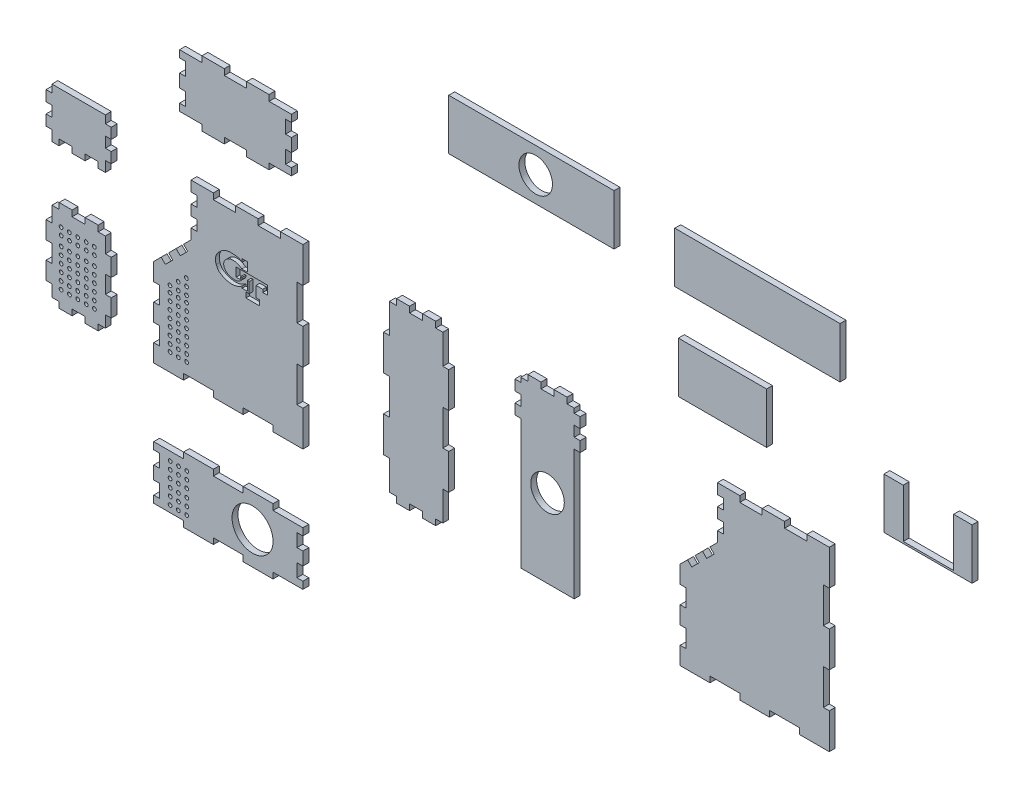
from build123d import *
from OCP.BRepAlgoAPI import BRepAlgoAPI_Cut
from OCP.TopTools import TopTools_ListOfShape

# Parameters (mm, degrees)
BOSS_EXTRUDE1_DEPTH    = 3.175
BOSS_EXTRUDE1_2_DEPTH  = 3.175
SKETCH1_W              = 35
SKETCH1_H              = 95
BOSS_EXTRUDE1_3_DEPTH  = 3.175
SKETCH1_W_2            = 47.3
SKETCH1_H_2            = 27.15
BOSS_EXTRUDE1_4_DEPTH  = 3.175
SKETCH1_W_3            = 80
SKETCH1_H_3            = 35
BOSS_EXTRUDE1_5_DEPTH  = 3.175
BOSS_EXTRUDE1_6_DEPTH  = 3.175
SKETCH1_W_4            = 88.65
BOSS_EXTRUDE1_7_DEPTH  = 3.175
SKETCH1_H_4            = 49.16783217
BOSS_EXTRUDE1_8_DEPTH  = 3.175
SKETCH1_H_5            = 26.78
BOSS_EXTRUDE1_9_DEPTH  = 3.175
BOSS_EXTRUDE1_10_DEPTH = 3.175
BOSS_EXTRUDE1_11_DEPTH = 3.175
SKETCH1_W_5            = 60
BOSS_EXTRUDE1_12_DEPTH = 3.175
SKETCH2_W              = 3.175
SKETCH2_H              = 19
CUT_EXTRUDE1_DEPTH     = 3.175
SKETCH2_3_W            = 3.175
SKETCH2_3_H            = 19
CUT_EXTRUDE2_DEPTH     = 3.175
SKETCH5_W              = 16
SKETCH5_H              = 3.175
CUT_EXTRUDE9_DEPTH     = 3.175
SKETCH5_3_W            = 16
SKETCH5_3_H            = 3.175
CUT_EXTRUDE10_DEPTH    = 3.175
SKETCH10_W             = 12
SKETCH10_H             = 3.175
CUT_EXTRUDE22_DEPTH    = 10
SKETCH10_3_W           = 12
SKETCH10_3_H           = 3.175
CUT_EXTRUDE23_DEPTH    = 10
SKETCH24_W             = 3.175
SKETCH24_H             = 9.43
CUT_EXTRUDE58_DEPTH    = 10
SKETCH24_3_W           = 3.175
SKETCH24_3_H           = 9.43
CUT_EXTRUDE59_DEPTH    = 10
CUT_EXTRUDE66_DEPTH    = 10
CUT_EXTRUDE67_DEPTH    = 10
SKETCH31_W             = 3.175
SKETCH31_H             = 5.57
CUT_EXTRUDE77_DEPTH    = 10
SKETCH31_3_W           = 3.175
SKETCH31_3_H           = 5.57
CUT_EXTRUDE78_DEPTH    = 10
SKETCH33_R             = 1
CUT_EXTRUDE80_DEPTH    = 10
CUT_EXTRUDE83_DEPTH    = 2
SKETCH38_W             = 16
SKETCH38_H             = 3.175
CUT_EXTRUDE85_DEPTH    = 10
SKETCH38_4_W           = 16
SKETCH38_4_H           = 3.175
CUT_EXTRUDE86_DEPTH    = 10
SKETCH38_9_W           = 3.175
SKETCH38_9_H           = 5.57
CUT_EXTRUDE91_DEPTH    = 10
SKETCH38_5_W           = 3.175
SKETCH38_5_H           = 19
CUT_EXTRUDE87_DEPTH    = 10
SKETCH38_6_W           = 3.175
SKETCH38_6_H           = 19
CUT_EXTRUDE88_DEPTH    = 10
SKETCH38_7_W           = 12
SKETCH38_7_H           = 3.175
CUT_EXTRUDE89_DEPTH    = 10
SKETCH38_8_W           = 12
SKETCH38_8_H           = 3.175
CUT_EXTRUDE90_DEPTH    = 10
SKETCH38_10_W          = 3.175
SKETCH38_10_H          = 5.57
CUT_EXTRUDE92_DEPTH    = 10
SKETCH38_11_W          = 3.175
SKETCH38_11_H          = 9.43
CUT_EXTRUDE93_DEPTH    = 10
SKETCH38_12_W          = 3.175
SKETCH38_12_H          = 9.43
CUT_EXTRUDE94_DEPTH    = 10
CUT_EXTRUDE95_DEPTH    = 10
CUT_EXTRUDE96_DEPTH    = 10
SKETCH31_4_W           = 3.175
SKETCH31_4_H           = 5.57
SKETCH31_4_H_2         = 5.552167833
CUT_EXTRUDE100_DEPTH   = 10
SKETCH31_5_W           = 3.175
SKETCH31_5_H           = 5.57
SKETCH31_5_H_2         = 5.552167833
CUT_EXTRUDE101_DEPTH   = 10
SKETCH31_6_W           = 3.175
SKETCH31_6_H           = 67.167832167
CUT_EXTRUDE102_DEPTH   = 10
SKETCH31_7_W           = 28.650019884
SKETCH31_7_H           = 3.175
CUT_EXTRUDE103_DEPTH   = 10
SKETCH5_4_W            = 16
SKETCH5_4_H            = 3.175
CUT_EXTRUDE104_DEPTH   = 10
SKETCH5_5_W            = 16
SKETCH5_5_H            = 3.175
CUT_EXTRUDE105_DEPTH   = 10
SKETCH2_4_W            = 3.175
SKETCH2_4_H            = 19
CUT_EXTRUDE106_DEPTH   = 10
SKETCH2_5_W            = 3.175
SKETCH2_5_H            = 19
CUT_EXTRUDE107_DEPTH   = 10
SKETCH39_W             = 3.175
SKETCH39_H             = 7
CUT_EXTRUDE108_DEPTH   = 10
SKETCH39_4_W           = 3.825
SKETCH39_4_H           = 3.175
SKETCH39_4_W_2         = 7
CUT_EXTRUDE110_DEPTH   = 10
SKETCH39_5_W           = 3.825
SKETCH39_5_H           = 3.175
SKETCH39_5_W_2         = 7
SKETCH39_5_W_3         = 3.825574946
CUT_EXTRUDE111_DEPTH   = 10
SKETCH40_R             = 9
CUT_EXTRUDE112_DEPTH   = 10
SKETCH24_4_W           = 3.175
SKETCH24_4_H           = 9.447832167
SKETCH24_4_H_2         = 9.43
CUT_EXTRUDE113_DEPTH   = 10
SKETCH24_5_W           = 3.175
SKETCH24_5_H           = 2.000000003
CUT_EXTRUDE114_DEPTH   = 10
SKETCH41_W             = 7
SKETCH41_H             = 3.175
SKETCH41_W_2           = 3.825
CUT_EXTRUDE115_DEPTH   = 10
SKETCH33_2_R           = 1
CUT_EXTRUDE116_DEPTH   = 10
SKETCH41_3_W           = 7
SKETCH41_3_H           = 3.175
CUT_EXTRUDE117_DEPTH   = 10
SKETCH27_4_W           = 3.175
SKETCH27_4_H           = 5.641992972
SKETCH27_4_H_2         = 5.66
CUT_EXTRUDE118_DEPTH   = 10
SKETCH10_8_W           = 12
SKETCH10_8_H           = 3.175
CUT_EXTRUDE119_DEPTH   = 10
SKETCH42_W             = 3.175
SKETCH42_H             = 7
CUT_EXTRUDE120_DEPTH   = 10
SKETCH43_R             = 9
CUT_EXTRUDE121_DEPTH   = 10
SKETCH49_R             = 11
CUT_EXTRUDE126_DEPTH   = 10
SKETCH50_W             = 27
SKETCH50_H             = 26.15
CUT_EXTRUDE127_DEPTH   = 10
SKETCH33_3_R           = 1
CUT_EXTRUDE128_DEPTH   = 10


with BuildPart() as part:
    # Sketch1 → Boss-Extrude1 (new body)
    with BuildSketch(Plane.XY):
        Polygon((-52.727272727, -38.566433566), (-52.727272727, 8.601398601), (-32.727272727, 28.601398601), (-32.727272727, 56.433566434), (27.272727273, 56.433566434), (27.272727273, -38.566433566), align=None)
    extrude(amount=BOSS_EXTRUDE1_DEPTH)

    # Sketch2 → Cut-Extrude1 (cut)
    with BuildSketch(Plane.XY.offset(3.175)):
        with Locations((25.685227273, 27.933566434)):
            Rectangle(SKETCH2_W, SKETCH2_H)
    extrude(amount=-CUT_EXTRUDE1_DEPTH, mode=Mode.SUBTRACT)

    # Sketch2<3> → Cut-Extrude2 (cut)
    with BuildSketch(Plane.XY.offset(3.175)):
        with Locations((25.685227273, -10.066433566)):
            Rectangle(SKETCH2_3_W, SKETCH2_3_H)
    extrude(amount=-CUT_EXTRUDE2_DEPTH, mode=Mode.SUBTRACT)

    # Sketch5 → Cut-Extrude9 (cut)
    with BuildSketch(Plane.XY.offset(3.175)):
        with Locations((-28.727272727, -36.978933566)):
            Rectangle(SKETCH5_W, SKETCH5_H)
    extrude(amount=-CUT_EXTRUDE9_DEPTH, mode=Mode.SUBTRACT)

    # Sketch5<3> → Cut-Extrude10 (cut)
    with BuildSketch(Plane.XY.offset(3.175)):
        with Locations((3.272727273, -36.978933566)):
            Rectangle(SKETCH5_3_W, SKETCH5_3_H)
    extrude(amount=-CUT_EXTRUDE10_DEPTH, mode=Mode.SUBTRACT)

    # Sketch10 → Cut-Extrude22 (cut)
    with BuildSketch(Plane.XY.offset(3.175)):
        with Locations((9.272727273, 54.846066434)):
            Rectangle(SKETCH10_W, SKETCH10_H)
    extrude(amount=-CUT_EXTRUDE22_DEPTH, mode=Mode.SUBTRACT)

    # Sketch10<3> → Cut-Extrude23 (cut)
    with BuildSketch(Plane.XY.offset(3.175)):
        with Locations((-14.727272727, 54.846066434)):
            Rectangle(SKETCH10_3_W, SKETCH10_3_H)
    extrude(amount=-CUT_EXTRUDE23_DEPTH, mode=Mode.SUBTRACT)

    # Sketch24 → Cut-Extrude58 (cut)
    with BuildSketch(Plane.XY.offset(3.175)):
        with Locations((-51.139772727, -24.403601399)):
            Rectangle(SKETCH24_W, SKETCH24_H)
    extrude(amount=-CUT_EXTRUDE58_DEPTH, mode=Mode.SUBTRACT)

    # Sketch24<3> → Cut-Extrude59 (cut)
    with BuildSketch(Plane.XY.offset(3.175)):
        with Locations((-51.139772727, -5.543601399)):
            Rectangle(SKETCH24_3_W, SKETCH24_3_H)
    extrude(amount=-CUT_EXTRUDE59_DEPTH, mode=Mode.SUBTRACT)

    # Sketch27 → Cut-Extrude66 (cut)
    with BuildSketch(Plane.XY.offset(3.175)):
        Polygon((-34.484433079, 22.35411019), (-36.729497109, 24.59917422), (-40.73172149, 20.596949838), (-38.48665746, 18.351885808), align=None)
    extrude(amount=-CUT_EXTRUDE66_DEPTH, mode=Mode.SUBTRACT)

    # Sketch27<3> → Cut-Extrude67 (cut)
    with BuildSketch(Plane.XY.offset(3.175)):
        Polygon((-42.488881842, 14.349661427), (-44.733945872, 16.594725457), (-48.736170253, 12.592501075), (-46.491106223, 10.347437045), align=None)
    extrude(amount=-CUT_EXTRUDE67_DEPTH, mode=Mode.SUBTRACT)

    # Sketch31 → Cut-Extrude77 (cut)
    with BuildSketch(Plane.XY.offset(3.175)):
        with Locations((-31.139772727, 48.078566434)):
            Rectangle(SKETCH31_W, SKETCH31_H)
    extrude(amount=-CUT_EXTRUDE77_DEPTH, mode=Mode.SUBTRACT)

    # Sketch31<3> → Cut-Extrude78 (cut)
    with BuildSketch(Plane.XY.offset(3.175)):
        with Locations((-31.139772727, 36.938566434)):
            Rectangle(SKETCH31_3_W, SKETCH31_3_H)
    extrude(amount=-CUT_EXTRUDE78_DEPTH, mode=Mode.SUBTRACT)

    # Sketch33 → Cut-Extrude80 (cut)
    with BuildSketch(Plane.XY.offset(3.175)):
        with Locations((-102.422296116, -25.319219434)):
            Circle(SKETCH33_R)
        with Locations((-93.463332087, -29.37228954)):
            Circle(SKETCH33_R)
        with Locations((-44.020894169, -1.572565629)):
            Circle(SKETCH33_R)
        with Locations((-39.596856193, -9.715431225)):
            Circle(SKETCH33_R)
        with Locations((-93.535082885, -25.497746444)):
            Circle(SKETCH33_R)
        with Locations((-39.596856193, -1.751092639)):
            Circle(SKETCH33_R)
        with Locations((-39.596856193, -13.700578421)):
            Circle(SKETCH33_R)
        with Locations((-44.020894169, -13.522051411)):
            Circle(SKETCH33_R)
        with Locations((-35.133680938, -13.700578421)):
            Circle(SKETCH33_R)
        with Locations((-35.06193014, -17.575121517)):
            Circle(SKETCH33_R)
        with Locations((-43.949143371, -17.396594506)):
            Circle(SKETCH33_R)
        with Locations((-39.525105395, -17.575121517)):
            Circle(SKETCH33_R)
        with Locations((-102.350545318, -21.229423944)):
            Circle(SKETCH33_R)
        with Locations((-97.99825814, -25.497746444)):
            Circle(SKETCH33_R)
        with Locations((-97.926507342, -21.407950954)):
            Circle(SKETCH33_R)
        with Locations((-35.06193014, -25.539460103)):
            Circle(SKETCH33_R)
        with Locations((-39.525105395, -25.539460103)):
            Circle(SKETCH33_R)
        with Locations((-97.926507342, -29.37228954)):
            Circle(SKETCH33_R)
        with Locations((-44.020894169, -21.486389997)):
            Circle(SKETCH33_R)
        with Locations((-39.596856193, -21.664917007)):
            Circle(SKETCH33_R)
        with Locations((-93.463332087, -21.407950954)):
            Circle(SKETCH33_R)
        with Locations((-43.949143371, -25.360933093)):
            Circle(SKETCH33_R)
        with Locations((-35.133680938, -21.664917007)):
            Circle(SKETCH33_R)
        with Locations((-102.422296116, -29.37228954)):
            Circle(SKETCH33_R)
        with Locations((-88.903151614, -21.407950954)):
            Circle(SKETCH33_R)
        with Locations((-88.903151614, -29.37228954)):
            Circle(SKETCH33_R)
        with Locations((-88.974902412, -25.497746444)):
            Circle(SKETCH33_R)
        with Locations((-84.537114697, -21.407950954)):
            Circle(SKETCH33_R)
        with Locations((-84.537114697, -29.37228954)):
            Circle(SKETCH33_R)
        with Locations((-84.608865495, -25.497746444)):
            Circle(SKETCH33_R)
        with Locations((-88.903151614, -17.384468334)):
            Circle(SKETCH33_R)
        with Locations((-93.463332087, -9.420129748)):
            Circle(SKETCH33_R)
        with Locations((-84.608865495, -13.509925238)):
            Circle(SKETCH33_R)
        with Locations((-97.99825814, -13.509925238)):
            Circle(SKETCH33_R)
        with Locations((-88.974902412, -13.509925238)):
            Circle(SKETCH33_R)
        with Locations((-102.350545318, -17.205941324)):
            Circle(SKETCH33_R)
        with Locations((-97.926507342, -9.420129748)):
            Circle(SKETCH33_R)
        with Locations((-93.463332087, -17.384468334)):
            Circle(SKETCH33_R)
        with Locations((-84.537114697, -9.420129748)):
            Circle(SKETCH33_R)
        with Locations((-93.535082885, -13.509925238)):
            Circle(SKETCH33_R)
        with Locations((-88.903151614, -9.420129748)):
            Circle(SKETCH33_R)
        with Locations((-97.926507342, -17.384468334)):
            Circle(SKETCH33_R)
        with Locations((-102.422296116, -13.331398228)):
            Circle(SKETCH33_R)
        with Locations((-84.537114697, -17.384468334)):
            Circle(SKETCH33_R)
        with Locations((-102.350545318, -9.241602738)):
            Circle(SKETCH33_R)
        with Locations((-35.205431736, 9.64732343)):
            Circle(SKETCH33_R)
        with Locations((-44.020894169, 1.861511854)):
            Circle(SKETCH33_R)
        with Locations((-35.133680938, 5.772780334)):
            Circle(SKETCH33_R)
        with Locations((-39.596856193, 5.772780334)):
            Circle(SKETCH33_R)
        with Locations((-35.133680938, 1.682984844)):
            Circle(SKETCH33_R)
        with Locations((-39.596856193, 1.682984844)):
            Circle(SKETCH33_R)
        with Locations((-43.949143371, -5.447108725)):
            Circle(SKETCH33_R)
        with Locations((-35.133680938, -1.751092639)):
            Circle(SKETCH33_R)
        with Locations((-39.525105395, -5.625635735)):
            Circle(SKETCH33_R)
        with Locations((-35.06193014, -5.625635735)):
            Circle(SKETCH33_R)
        with Locations((-44.020894169, -9.536904215)):
            Circle(SKETCH33_R)
        with Locations((-35.133680938, -9.715431225)):
            Circle(SKETCH33_R)
        with Locations((-39.525105395, -29.265846321)):
            Circle(SKETCH33_R)
        with Locations((-35.06193014, -29.265846321)):
            Circle(SKETCH33_R)
        with Locations((-43.949143371, -29.087319311)):
            Circle(SKETCH33_R)
        with Locations((-39.453354597, -83.90048602)):
            Circle(SKETCH33_R)
        with Locations((-97.926507342, -4.364968768)):
            Circle(SKETCH33_R)
        with Locations((-88.974902412, -0.490425672)):
            Circle(SKETCH33_R)
        with Locations((-43.877392573, -96.134859811)):
            Circle(SKETCH33_R)
        with Locations((-93.463332087, -4.364968768)):
            Circle(SKETCH33_R)
        with Locations((-88.903151614, -4.364968768)):
            Circle(SKETCH33_R)
        with Locations((-84.537114697, -4.364968768)):
            Circle(SKETCH33_R)
        with Locations((-34.990179342, -92.289904201)):
            Circle(SKETCH33_R)
        with Locations((-97.99825814, -0.490425672)):
            Circle(SKETCH33_R)
        with Locations((-93.535082885, -0.490425672)):
            Circle(SKETCH33_R)
        with Locations((-84.608865495, -0.490425672)):
            Circle(SKETCH33_R)
        with Locations((-102.350545318, -4.186441758)):
            Circle(SKETCH33_R)
        with Locations((-102.422296116, -0.311898662)):
            Circle(SKETCH33_R)
        with Locations((-43.949143371, -87.8117545)):
            Circle(SKETCH33_R)
        with Locations((-34.990179342, -96.313386821)):
            Circle(SKETCH33_R)
        with Locations((-43.877392573, -83.72195901)):
            Circle(SKETCH33_R)
        with Locations((-39.525105395, -100.403182311)):
            Circle(SKETCH33_R)
        with Locations((-39.453354597, -92.289904201)):
            Circle(SKETCH33_R)
        with Locations((-34.990179342, -79.877003401)):
            Circle(SKETCH33_R)
        with Locations((-39.453354597, -79.877003401)):
            Circle(SKETCH33_R)
        with Locations((-39.453354597, -96.313386821)):
            Circle(SKETCH33_R)
        with Locations((-43.877392573, -79.69847639)):
            Circle(SKETCH33_R)
        with Locations((-34.990179342, -83.90048602)):
            Circle(SKETCH33_R)
        with Locations((-35.06193014, -100.403182311)):
            Circle(SKETCH33_R)
        with Locations((-43.877392573, -92.111377191)):
            Circle(SKETCH33_R)
        with Locations((-43.949143371, -100.224655301)):
            Circle(SKETCH33_R)
        with Locations((-39.525105395, -87.99028151)):
            Circle(SKETCH33_R)
        with Locations((-35.06193014, -87.99028151)):
            Circle(SKETCH33_R)
    extrude(amount=-CUT_EXTRUDE80_DEPTH, mode=Mode.SUBTRACT)

    # Sketch37 → Cut-Extrude83 (cut)
    with BuildSketch(Plane.XY.offset(3.175)):
        with BuildLine():
            Line((-5.324968925, 20.865602215), (-5.324968925, 19.837885772))
            Line((-5.324968925, 19.837885772), (-2.478899949, 19.837885772))
            Line((-2.478899949, 19.837885772), (-2.478899949, 24.916451412))
            Line((-2.478899949, 24.916451412), (-1.528952419, 24.916451412))
            Line((-1.528952419, 24.916451412), (-1.528952419, 19.162303456))
            Line((-1.528952419, 19.162303456), (-1.539953864, 19.162303456))
            Line((-1.539953864, 19.162303456), (-3.286861994, 19.162303456))
            Line((-3.286861994, 19.162303456), (-3.286861994, 16.327977938))
            Line((-3.286861994, 16.327977938), (3.978916432, 16.327977938))
            Line((3.978916432, 16.327977938), (3.978916432, 19.162303456))
            Line((3.978916432, 19.162303456), (2.179496592, 19.162303456))
            Line((2.179496592, 19.162303456), (2.179496592, 24.916451412))
            Line((2.179496592, 24.916451412), (5.778336273, 24.916451412))
            Line((5.778336273, 24.916451412), (5.778336273, 23.418457231))
            Line((5.778336273, 23.418457231), (8.324193391, 23.418457231))
            Line((8.324193391, 23.418457231), (8.324193391, 28.11040633))
            Line((8.324193391, 28.11040633), (-8.4873193, 28.11040633))
            Line((-8.4873193, 28.11040633), (-8.4873193, 23.418457231))
            Line((-8.4873193, 23.418457231), (-6.054954107, 23.418457231))
            Line((-6.054954107, 23.418457231), (-6.054954107, 24.916451412))
            Line((-6.054954107, 24.916451412), (-5.324968925, 24.916451412))
            add(Edge.make_bspline(
                [(-5.324968925, 24.916451412), (-5.303086679, 24.557108285), (-5.307844698, 23.990241291), (-5.770388788, 23.277741714), (-6.3438022, 22.66726673), (-7.249301258, 22.159544486), (-8.237658587, 21.839978567), (-9.40415045, 21.785912177), (-10.631485969, 21.826296915), (-11.975077096, 22.199583892), (-13.315800799, 22.775157711), (-14.3458714, 23.772978179), (-15.044910644, 24.905956276), (-15.24484346, 26.164307761), (-15.096747233, 27.297468215), (-14.600105242, 28.157256206), (-14.082601889, 28.77515515), (-13.425775898, 29.417531401), (-12.615935127, 29.777010926), (-11.865052178, 30.184554137), (-11.087824477, 30.358084245), (-10.364768935, 30.470355647), (-9.677251004, 30.441636402), (-9.042598664, 30.401398206), (-8.422069088, 30.230879432), (-7.825315753, 30.118436981), (-7.305685913, 29.901931729), (-6.845312315, 29.654591003), (-6.437430984, 29.421586801), (-6.042752269, 29.157600931), (-5.76306293, 28.934992666), (-5.589601675, 28.718061903), (-5.49956793, 28.733961993), (-5.472166037, 28.73322029)],
                knots=[0, 0, 0, 0, 0.04254412, 0.060286393, 0.096269742, 0.137541884, 0.177829573, 0.214128788, 0.270775703, 0.317697149, 0.37328066, 0.436073823, 0.478784828, 0.523491973, 0.579606765, 0.605567187, 0.63619465, 0.672043613, 0.70940653, 0.7368543, 0.769624708, 0.79990688, 0.820445741, 0.848333817, 0.872505051, 0.89399699, 0.91777412, 0.936607379, 0.95386599, 0.971753579, 0.990295395, 0.996831118, 1, 1, 1, 1], degree=3))
            Line((-5.472166037, 28.73322029), (-2.540706636, 28.73322029))
            Line((-2.540706636, 28.73322029), (-2.540706636, 33.623912114))
            Line((-2.540706636, 33.623912114), (-5.324968925, 33.623912114))
            Line((-5.324968925, 33.623912114), (-5.324968925, 31.926949311))
            add(Edge.make_bspline(
                [(-8.397455095, 33.292160376), (-7.862254154, 33.184946621), (-7.15409909, 32.975022431), (-6.147661151, 32.461255133), (-5.641357454, 32.170526179), (-5.324968925, 31.926949311)],
                knots=[0, 0, 0, 0, 0.484190928, 0.647264819, 1, 1, 1, 1], degree=3))
            add(Edge.make_bspline(
                [(-18.055910995, 30.109459957), (-17.406800632, 30.765883131), (-16.433014577, 31.915355157), (-14.734698356, 32.805711206), (-13.371501368, 33.190793338), (-11.302521942, 33.567637488), (-9.604062155, 33.376156135), (-8.397455095, 33.292160376)],
                knots=[0, 0, 0, 0, 0.261685334, 0.412659425, 0.529814901, 0.658125542, 1, 1, 1, 1], degree=3))
            add(Edge.make_bspline(
                [(-19.194687389, 23.947761873), (-19.48066838, 24.620132337), (-19.610428413, 25.707563233), (-19.513595653, 27.907294029), (-18.83320697, 29.303099886), (-18.055910995, 30.109459957)],
                knots=[0, 0, 0, 0, 0.328808449, 0.493850023, 1, 1, 1, 1], degree=3))
            add(Edge.make_bspline(
                [(-19.194687389, 23.947761873), (-18.863021755, 23.081230941), (-18.0915975, 21.52338365), (-16.116394915, 20.395361566), (-14.385319032, 19.575456309), (-12.464662826, 19.095705463), (-10.25562346, 18.887282038), (-7.725944867, 19.414185036), (-6.11930607, 20.289602877), (-5.324968925, 20.865602215)],
                knots=[0, 0, 0, 0, 0.175851154, 0.301976298, 0.411574769, 0.530358286, 0.665653971, 0.818540732, 1, 1, 1, 1], degree=3))
        make_face()
    extrude(amount=-CUT_EXTRUDE83_DEPTH, mode=Mode.SUBTRACT)


with BuildPart() as body_2:
    # Sketch1 → Boss-Extrude1 2 (new body)
    with BuildSketch(Plane.XY):
        Polygon((249.647593351, 57.021847405), (249.647593351, 29.189679572), (229.647593351, 9.189679572), (229.647593351, -37.978152595), (309.647593351, -37.978152595), (309.647593351, 57.021847405), align=None)
    extrude(amount=BOSS_EXTRUDE1_2_DEPTH)

    # Sketch38 → Cut-Extrude85 (cut)
    with BuildSketch(Plane.XY.offset(3.175)):
        with Locations((253.647593351, -36.390652595)):
            Rectangle(SKETCH38_W, SKETCH38_H)
    extrude(amount=-CUT_EXTRUDE85_DEPTH, mode=Mode.SUBTRACT)

    # Sketch38<4> → Cut-Extrude86 (cut)
    with BuildSketch(Plane.XY.offset(3.175)):
        with Locations((285.647593351, -36.390652595)):
            Rectangle(SKETCH38_4_W, SKETCH38_4_H)
    extrude(amount=-CUT_EXTRUDE86_DEPTH, mode=Mode.SUBTRACT)

    # Sketch38<9> → Cut-Extrude91 (cut)
    with BuildSketch(Plane.XY.offset(3.175)):
        with Locations((251.235093351, 48.666847405)):
            Rectangle(SKETCH38_9_W, SKETCH38_9_H)
    extrude(amount=-CUT_EXTRUDE91_DEPTH, mode=Mode.SUBTRACT)

    # Sketch38<5> → Cut-Extrude87 (cut)
    with BuildSketch(Plane.XY.offset(3.175)):
        with Locations((308.060093351, -9.478152595)):
            Rectangle(SKETCH38_5_W, SKETCH38_5_H)
    extrude(amount=-CUT_EXTRUDE87_DEPTH, mode=Mode.SUBTRACT)

    # Sketch38<6> → Cut-Extrude88 (cut)
    with BuildSketch(Plane.XY.offset(3.175)):
        with Locations((308.060093351, 28.521847405)):
            Rectangle(SKETCH38_6_W, SKETCH38_6_H)
    extrude(amount=-CUT_EXTRUDE88_DEPTH, mode=Mode.SUBTRACT)

    # Sketch38<7> → Cut-Extrude89 (cut)
    with BuildSketch(Plane.XY.offset(3.175)):
        with Locations((291.647593351, 55.434347405)):
            Rectangle(SKETCH38_7_W, SKETCH38_7_H)
    extrude(amount=-CUT_EXTRUDE89_DEPTH, mode=Mode.SUBTRACT)

    # Sketch38<8> → Cut-Extrude90 (cut)
    with BuildSketch(Plane.XY.offset(3.175)):
        with Locations((267.647593351, 55.434347405)):
            Rectangle(SKETCH38_8_W, SKETCH38_8_H)
    extrude(amount=-CUT_EXTRUDE90_DEPTH, mode=Mode.SUBTRACT)

    # Sketch38<10> → Cut-Extrude92 (cut)
    with BuildSketch(Plane.XY.offset(3.175)):
        with Locations((251.235093351, 37.526847405)):
            Rectangle(SKETCH38_10_W, SKETCH38_10_H)
    extrude(amount=-CUT_EXTRUDE92_DEPTH, mode=Mode.SUBTRACT)

    # Sketch38<11> → Cut-Extrude93 (cut)
    with BuildSketch(Plane.XY.offset(3.175)):
        with Locations((231.235093351, -23.815320428)):
            Rectangle(SKETCH38_11_W, SKETCH38_11_H)
    extrude(amount=-CUT_EXTRUDE93_DEPTH, mode=Mode.SUBTRACT)

    # Sketch38<12> → Cut-Extrude94 (cut)
    with BuildSketch(Plane.XY.offset(3.175)):
        with Locations((231.235093351, -4.955320428)):
            Rectangle(SKETCH38_12_W, SKETCH38_12_H)
    extrude(amount=-CUT_EXTRUDE94_DEPTH, mode=Mode.SUBTRACT)

    # Sketch38<13> → Cut-Extrude95 (cut)
    with BuildSketch(Plane.XY.offset(3.175)):
        Polygon((245.64536897, 25.187455191), (241.643144588, 21.185230809), (243.888208619, 18.940166779), (247.890433, 22.942391161), align=None)
    extrude(amount=-CUT_EXTRUDE95_DEPTH, mode=Mode.SUBTRACT)

    # Sketch38<14> → Cut-Extrude96 (cut)
    with BuildSketch(Plane.XY.offset(3.175)):
        Polygon((237.640920207, 17.183006428), (233.638695825, 13.180782046), (235.883759856, 10.935718016), (239.885984237, 14.937942398), align=None)
    extrude(amount=-CUT_EXTRUDE96_DEPTH, mode=Mode.SUBTRACT)


with BuildPart() as body_3:
    # Sketch1 → Boss-Extrude1 3 (new body)
    with BuildSketch(Plane.XY):
        with Locations((88.020299211, 8.933566434)):
            Rectangle(SKETCH1_W, SKETCH1_H)
    extrude(amount=BOSS_EXTRUDE1_3_DEPTH)

    # Sketch2<4> → Cut-Extrude106 (cut)
    with BuildSketch(Plane.XY.offset(3.175)):
        with Locations((72.107799211, 46.933566434)):
            Rectangle(SKETCH2_4_W, SKETCH2_4_H)
        with Locations((72.107799211, 8.933566434)):
            Rectangle(SKETCH2_4_W, SKETCH2_4_H)
        with Locations((72.107799211, -29.066433566)):
            Rectangle(SKETCH2_4_W, SKETCH2_4_H)
    extrude(amount=-CUT_EXTRUDE106_DEPTH, mode=Mode.SUBTRACT)

    # Sketch2<5> → Cut-Extrude107 (cut)
    with BuildSketch(Plane.XY.offset(3.175)):
        with Locations((103.932799211, 46.933566434)):
            Rectangle(SKETCH2_5_W, SKETCH2_5_H)
        with Locations((103.932799211, 8.933566434)):
            Rectangle(SKETCH2_5_W, SKETCH2_5_H)
        with Locations((103.932799211, -29.066433566)):
            Rectangle(SKETCH2_5_W, SKETCH2_5_H)
    extrude(amount=-CUT_EXTRUDE107_DEPTH, mode=Mode.SUBTRACT)


with BuildPart() as body_4:
    # Sketch1 → Boss-Extrude1 4 (new body)
    with BuildSketch(Plane.XY):
        with Locations((362.596808239, 92.122131129)):
            Rectangle(SKETCH1_W_2, SKETCH1_H_2)
    extrude(amount=BOSS_EXTRUDE1_4_DEPTH)

    # Sketch50 → Cut-Extrude127 (cut)
    with BuildSketch(Plane.XY.offset(3.175)):
        with Locations((362.836264573, 92.622131129)):
            Rectangle(SKETCH50_W, SKETCH50_H)
    extrude(amount=-CUT_EXTRUDE127_DEPTH, mode=Mode.SUBTRACT)


with BuildPart() as body_5:
    # Sketch1 → Boss-Extrude1 5 (new body)
    with BuildSketch(Plane.XY):
        with Locations((-12.727272727, -89.42853763)):
            Rectangle(SKETCH1_W_3, SKETCH1_H_3)
    extrude(amount=BOSS_EXTRUDE1_5_DEPTH)

    # Sketch5<4> → Cut-Extrude104 (cut)
    with BuildSketch(Plane.XY.offset(3.175)):
        with Locations((-44.727272727, -73.51603763)):
            Rectangle(SKETCH5_4_W, SKETCH5_4_H)
        with Locations((-12.727272727, -73.51603763)):
            Rectangle(SKETCH5_4_W, SKETCH5_4_H)
        with Locations((19.272727273, -73.51603763)):
            Rectangle(SKETCH5_4_W, SKETCH5_4_H)
    extrude(amount=-CUT_EXTRUDE104_DEPTH, mode=Mode.SUBTRACT)

    # Sketch5<5> → Cut-Extrude105 (cut)
    with BuildSketch(Plane.XY.offset(3.175)):
        with Locations((-44.727272727, -105.34103763)):
            Rectangle(SKETCH5_5_W, SKETCH5_5_H)
        with Locations((-12.727272727, -105.34103763)):
            Rectangle(SKETCH5_5_W, SKETCH5_5_H)
        with Locations((19.272727273, -105.34103763)):
            Rectangle(SKETCH5_5_W, SKETCH5_5_H)
    extrude(amount=-CUT_EXTRUDE105_DEPTH, mode=Mode.SUBTRACT)

    # Sketch39 → Cut-Extrude108 (cut)
    with BuildSketch(Plane.XY.offset(3.175)):
        with Locations((25.685227273, -82.42853763)):
            Rectangle(SKETCH39_W, SKETCH39_H)
        with Locations((25.685227273, -96.42853763)):
            Rectangle(SKETCH39_W, SKETCH39_H)
        with Locations((-51.139772727, -82.42853763)):
            Rectangle(SKETCH39_W, SKETCH39_H)
        with Locations((-51.139772727, -96.42853763)):
            Rectangle(SKETCH39_W, SKETCH39_H)
    extrude(amount=-CUT_EXTRUDE108_DEPTH, mode=Mode.SUBTRACT)

    # Sketch49 → Cut-Extrude126 (cut)
    with BuildSketch(Plane.XY.offset(3.175)):
        with Locations((0.272727273, -89.42853763)):
            Circle(SKETCH49_R)
    extrude(amount=-CUT_EXTRUDE126_DEPTH, mode=Mode.SUBTRACT)

    # Sketch33<3> → Cut-Extrude128 (cut)
    with BuildSketch(Plane.XY.offset(3.175)):
        with Locations((-102.422296116, -25.319219434)):
            Circle(SKETCH33_3_R)
        with Locations((-93.463332087, -29.37228954)):
            Circle(SKETCH33_3_R)
        with Locations((-44.020894169, -1.572565629)):
            Circle(SKETCH33_3_R)
        with Locations((-39.596856193, -9.715431225)):
            Circle(SKETCH33_3_R)
        with Locations((-93.535082885, -25.497746444)):
            Circle(SKETCH33_3_R)
        with Locations((-39.596856193, -1.751092639)):
            Circle(SKETCH33_3_R)
        with Locations((-39.596856193, -13.700578421)):
            Circle(SKETCH33_3_R)
        with Locations((-44.020894169, -13.522051411)):
            Circle(SKETCH33_3_R)
        with Locations((-35.133680938, -13.700578421)):
            Circle(SKETCH33_3_R)
        with Locations((-35.06193014, -17.575121517)):
            Circle(SKETCH33_3_R)
        with Locations((-43.949143371, -17.396594506)):
            Circle(SKETCH33_3_R)
        with Locations((-39.525105395, -17.575121517)):
            Circle(SKETCH33_3_R)
        with Locations((-102.350545318, -21.229423944)):
            Circle(SKETCH33_3_R)
        with Locations((-97.99825814, -25.497746444)):
            Circle(SKETCH33_3_R)
        with Locations((-97.926507342, -21.407950954)):
            Circle(SKETCH33_3_R)
        with Locations((-35.06193014, -25.539460103)):
            Circle(SKETCH33_3_R)
        with Locations((-39.525105395, -25.539460103)):
            Circle(SKETCH33_3_R)
        with Locations((-97.926507342, -29.37228954)):
            Circle(SKETCH33_3_R)
        with Locations((-44.020894169, -21.486389997)):
            Circle(SKETCH33_3_R)
        with Locations((-39.596856193, -21.664917007)):
            Circle(SKETCH33_3_R)
        with Locations((-93.463332087, -21.407950954)):
            Circle(SKETCH33_3_R)
        with Locations((-43.949143371, -25.360933093)):
            Circle(SKETCH33_3_R)
        with Locations((-35.133680938, -21.664917007)):
            Circle(SKETCH33_3_R)
        with Locations((-102.422296116, -29.37228954)):
            Circle(SKETCH33_3_R)
        with Locations((-88.903151614, -21.407950954)):
            Circle(SKETCH33_3_R)
        with Locations((-88.903151614, -29.37228954)):
            Circle(SKETCH33_3_R)
        with Locations((-88.974902412, -25.497746444)):
            Circle(SKETCH33_3_R)
        with Locations((-84.537114697, -21.407950954)):
            Circle(SKETCH33_3_R)
        with Locations((-84.537114697, -29.37228954)):
            Circle(SKETCH33_3_R)
        with Locations((-84.608865495, -25.497746444)):
            Circle(SKETCH33_3_R)
        with Locations((-88.903151614, -17.384468334)):
            Circle(SKETCH33_3_R)
        with Locations((-93.463332087, -9.420129748)):
            Circle(SKETCH33_3_R)
        with Locations((-84.608865495, -13.509925238)):
            Circle(SKETCH33_3_R)
        with Locations((-97.99825814, -13.509925238)):
            Circle(SKETCH33_3_R)
        with Locations((-88.974902412, -13.509925238)):
            Circle(SKETCH33_3_R)
        with Locations((-102.350545318, -17.205941324)):
            Circle(SKETCH33_3_R)
        with Locations((-97.926507342, -9.420129748)):
            Circle(SKETCH33_3_R)
        with Locations((-93.463332087, -17.384468334)):
            Circle(SKETCH33_3_R)
        with Locations((-84.537114697, -9.420129748)):
            Circle(SKETCH33_3_R)
        with Locations((-93.535082885, -13.509925238)):
            Circle(SKETCH33_3_R)
        with Locations((-88.903151614, -9.420129748)):
            Circle(SKETCH33_3_R)
        with Locations((-97.926507342, -17.384468334)):
            Circle(SKETCH33_3_R)
        with Locations((-102.422296116, -13.331398228)):
            Circle(SKETCH33_3_R)
        with Locations((-84.537114697, -17.384468334)):
            Circle(SKETCH33_3_R)
        with Locations((-102.350545318, -9.241602738)):
            Circle(SKETCH33_3_R)
        with Locations((-35.205431736, 9.64732343)):
            Circle(SKETCH33_3_R)
        with Locations((-44.020894169, 1.861511854)):
            Circle(SKETCH33_3_R)
        with Locations((-35.133680938, 5.772780334)):
            Circle(SKETCH33_3_R)
        with Locations((-39.596856193, 5.772780334)):
            Circle(SKETCH33_3_R)
        with Locations((-35.133680938, 1.682984844)):
            Circle(SKETCH33_3_R)
        with Locations((-39.596856193, 1.682984844)):
            Circle(SKETCH33_3_R)
        with Locations((-43.949143371, -5.447108725)):
            Circle(SKETCH33_3_R)
        with Locations((-35.133680938, -1.751092639)):
            Circle(SKETCH33_3_R)
        with Locations((-39.525105395, -5.625635735)):
            Circle(SKETCH33_3_R)
        with Locations((-35.06193014, -5.625635735)):
            Circle(SKETCH33_3_R)
        with Locations((-44.020894169, -9.536904215)):
            Circle(SKETCH33_3_R)
        with Locations((-35.133680938, -9.715431225)):
            Circle(SKETCH33_3_R)
        with Locations((-39.525105395, -29.265846321)):
            Circle(SKETCH33_3_R)
        with Locations((-35.06193014, -29.265846321)):
            Circle(SKETCH33_3_R)
        with Locations((-43.949143371, -29.087319311)):
            Circle(SKETCH33_3_R)
        with Locations((-39.453354597, -83.90048602)):
            Circle(SKETCH33_3_R)
        with Locations((-97.926507342, -4.364968768)):
            Circle(SKETCH33_3_R)
        with Locations((-88.974902412, -0.490425672)):
            Circle(SKETCH33_3_R)
        with Locations((-43.877392573, -96.134859811)):
            Circle(SKETCH33_3_R)
        with Locations((-93.463332087, -4.364968768)):
            Circle(SKETCH33_3_R)
        with Locations((-88.903151614, -4.364968768)):
            Circle(SKETCH33_3_R)
        with Locations((-84.537114697, -4.364968768)):
            Circle(SKETCH33_3_R)
        with Locations((-34.990179342, -92.289904201)):
            Circle(SKETCH33_3_R)
        with Locations((-97.99825814, -0.490425672)):
            Circle(SKETCH33_3_R)
        with Locations((-93.535082885, -0.490425672)):
            Circle(SKETCH33_3_R)
        with Locations((-84.608865495, -0.490425672)):
            Circle(SKETCH33_3_R)
        with Locations((-102.350545318, -4.186441758)):
            Circle(SKETCH33_3_R)
        with Locations((-102.422296116, -0.311898662)):
            Circle(SKETCH33_3_R)
        with Locations((-43.949143371, -87.8117545)):
            Circle(SKETCH33_3_R)
        with Locations((-34.990179342, -96.313386821)):
            Circle(SKETCH33_3_R)
        with Locations((-43.877392573, -83.72195901)):
            Circle(SKETCH33_3_R)
        with Locations((-39.525105395, -100.403182311)):
            Circle(SKETCH33_3_R)
        with Locations((-39.453354597, -92.289904201)):
            Circle(SKETCH33_3_R)
        with Locations((-34.990179342, -79.877003401)):
            Circle(SKETCH33_3_R)
        with Locations((-39.453354597, -79.877003401)):
            Circle(SKETCH33_3_R)
        with Locations((-39.453354597, -96.313386821)):
            Circle(SKETCH33_3_R)
        with Locations((-43.877392573, -79.69847639)):
            Circle(SKETCH33_3_R)
        with Locations((-34.990179342, -83.90048602)):
            Circle(SKETCH33_3_R)
        with Locations((-35.06193014, -100.403182311)):
            Circle(SKETCH33_3_R)
        with Locations((-43.877392573, -92.111377191)):
            Circle(SKETCH33_3_R)
        with Locations((-43.949143371, -100.224655301)):
            Circle(SKETCH33_3_R)
        with Locations((-39.525105395, -87.99028151)):
            Circle(SKETCH33_3_R)
        with Locations((-35.06193014, -87.99028151)):
            Circle(SKETCH33_3_R)
    extrude(amount=-CUT_EXTRUDE128_DEPTH, mode=Mode.SUBTRACT)


with BuildPart() as body_6:
    # Sketch1 → Boss-Extrude1 6 (new body)
    with BuildSketch(Plane.XY):
        with Locations((158.506630001, 8.933566434)):
            Rectangle(SKETCH1_W, SKETCH1_H)
    extrude(amount=BOSS_EXTRUDE1_6_DEPTH)


with BuildPart() as body_7:
    # Sketch1 → Boss-Extrude1 7 (new body)
    with BuildSketch(Plane.XY):
        with Locations((271.082233091, 150.231993224)):
            Rectangle(SKETCH1_W_4, SKETCH1_H_2)
    extrude(amount=BOSS_EXTRUDE1_7_DEPTH)


with BuildPart() as body_8:
    # Sketch1 → Boss-Extrude1 8 (new body)
    with BuildSketch(Plane.XY):
        with Locations((-93.006498138, -13.982517481)):
            Rectangle(SKETCH1_W, SKETCH1_H_4)
    extrude(amount=BOSS_EXTRUDE1_8_DEPTH)

    # Sketch24<4> → Cut-Extrude113 (cut)
    with BuildSketch(Plane.XY.offset(3.175)):
        with Locations((-77.093998138, -33.842517482)):
            Rectangle(SKETCH24_4_W, SKETCH24_4_H)
        with Locations((-77.093998138, -14.973601399)):
            Rectangle(SKETCH24_4_W, SKETCH24_4_H_2)
        with Locations((-77.093998138, 3.886398601)):
            Rectangle(SKETCH24_4_W, SKETCH24_4_H_2)
        with Locations((-108.918998138, 3.886398601)):
            Rectangle(SKETCH24_4_W, SKETCH24_4_H_2)
        with Locations((-108.918998138, -14.973601399)):
            Rectangle(SKETCH24_4_W, SKETCH24_4_H_2)
        with Locations((-108.918998138, -33.842517482)):
            Rectangle(SKETCH24_4_W, SKETCH24_4_H)
    extrude(amount=-CUT_EXTRUDE113_DEPTH, mode=Mode.SUBTRACT)

    # Sketch24<5> → Cut-Extrude114 (cut)
    with BuildSketch(Plane.XY.offset(3.175)):
        with Locations((-108.918998138, 9.601398603)):
            Rectangle(SKETCH24_5_W, SKETCH24_5_H)
        with Locations((-77.093998138, 9.601398603)):
            Rectangle(SKETCH24_5_W, SKETCH24_5_H)
    extrude(amount=-CUT_EXTRUDE114_DEPTH, mode=Mode.SUBTRACT)

    # Sketch41 → Cut-Extrude115 (cut)
    with BuildSketch(Plane.XY.offset(3.175)):
        with Locations((-93.006498138, 9.013898604)):
            Rectangle(SKETCH41_W, SKETCH41_H)
        with Locations((-105.418998138, 9.013898604)):
            Rectangle(SKETCH41_W_2, SKETCH41_H)
        with Locations((-80.593998138, 9.013898604)):
            Rectangle(SKETCH41_W_2, SKETCH41_H)
        with Locations((-80.593998138, -36.978933566)):
            Rectangle(SKETCH41_W_2, SKETCH41_H)
        with Locations((-93.006498138, -36.978933566)):
            Rectangle(SKETCH41_W, SKETCH41_H)
        with Locations((-105.418998138, -36.978933566)):
            Rectangle(SKETCH41_W_2, SKETCH41_H)
    extrude(amount=-CUT_EXTRUDE115_DEPTH, mode=Mode.SUBTRACT)

    # Sketch33<2> → Cut-Extrude116 (cut)
    with BuildSketch(Plane.XY.offset(3.175)):
        with Locations((-102.422296116, -25.319219434)):
            Circle(SKETCH33_2_R)
        with Locations((-93.463332087, -29.37228954)):
            Circle(SKETCH33_2_R)
        with Locations((-44.020894169, -1.572565629)):
            Circle(SKETCH33_2_R)
        with Locations((-39.596856193, -9.715431225)):
            Circle(SKETCH33_2_R)
        with Locations((-93.535082885, -25.497746444)):
            Circle(SKETCH33_2_R)
        with Locations((-39.596856193, -1.751092639)):
            Circle(SKETCH33_2_R)
        with Locations((-39.596856193, -13.700578421)):
            Circle(SKETCH33_2_R)
        with Locations((-44.020894169, -13.522051411)):
            Circle(SKETCH33_2_R)
        with Locations((-35.133680938, -13.700578421)):
            Circle(SKETCH33_2_R)
        with Locations((-35.06193014, -17.575121517)):
            Circle(SKETCH33_2_R)
        with Locations((-43.949143371, -17.396594506)):
            Circle(SKETCH33_2_R)
        with Locations((-39.525105395, -17.575121517)):
            Circle(SKETCH33_2_R)
        with Locations((-102.350545318, -21.229423944)):
            Circle(SKETCH33_2_R)
        with Locations((-97.99825814, -25.497746444)):
            Circle(SKETCH33_2_R)
        with Locations((-97.926507342, -21.407950954)):
            Circle(SKETCH33_2_R)
        with Locations((-35.06193014, -25.539460103)):
            Circle(SKETCH33_2_R)
        with Locations((-39.525105395, -25.539460103)):
            Circle(SKETCH33_2_R)
        with Locations((-97.926507342, -29.37228954)):
            Circle(SKETCH33_2_R)
        with Locations((-44.020894169, -21.486389997)):
            Circle(SKETCH33_2_R)
        with Locations((-39.596856193, -21.664917007)):
            Circle(SKETCH33_2_R)
        with Locations((-93.463332087, -21.407950954)):
            Circle(SKETCH33_2_R)
        with Locations((-43.949143371, -25.360933093)):
            Circle(SKETCH33_2_R)
        with Locations((-35.133680938, -21.664917007)):
            Circle(SKETCH33_2_R)
        with Locations((-102.422296116, -29.37228954)):
            Circle(SKETCH33_2_R)
        with Locations((-88.903151614, -21.407950954)):
            Circle(SKETCH33_2_R)
        with Locations((-88.903151614, -29.37228954)):
            Circle(SKETCH33_2_R)
        with Locations((-88.974902412, -25.497746444)):
            Circle(SKETCH33_2_R)
        with Locations((-84.537114697, -21.407950954)):
            Circle(SKETCH33_2_R)
        with Locations((-84.537114697, -29.37228954)):
            Circle(SKETCH33_2_R)
        with Locations((-84.608865495, -25.497746444)):
            Circle(SKETCH33_2_R)
        with Locations((-88.903151614, -17.384468334)):
            Circle(SKETCH33_2_R)
        with Locations((-93.463332087, -9.420129748)):
            Circle(SKETCH33_2_R)
        with Locations((-84.608865495, -13.509925238)):
            Circle(SKETCH33_2_R)
        with Locations((-97.99825814, -13.509925238)):
            Circle(SKETCH33_2_R)
        with Locations((-88.974902412, -13.509925238)):
            Circle(SKETCH33_2_R)
        with Locations((-102.350545318, -17.205941324)):
            Circle(SKETCH33_2_R)
        with Locations((-97.926507342, -9.420129748)):
            Circle(SKETCH33_2_R)
        with Locations((-93.463332087, -17.384468334)):
            Circle(SKETCH33_2_R)
        with Locations((-84.537114697, -9.420129748)):
            Circle(SKETCH33_2_R)
        with Locations((-93.535082885, -13.509925238)):
            Circle(SKETCH33_2_R)
        with Locations((-88.903151614, -9.420129748)):
            Circle(SKETCH33_2_R)
        with Locations((-97.926507342, -17.384468334)):
            Circle(SKETCH33_2_R)
        with Locations((-102.422296116, -13.331398228)):
            Circle(SKETCH33_2_R)
        with Locations((-84.537114697, -17.384468334)):
            Circle(SKETCH33_2_R)
        with Locations((-102.350545318, -9.241602738)):
            Circle(SKETCH33_2_R)
        with Locations((-35.205431736, 9.64732343)):
            Circle(SKETCH33_2_R)
        with Locations((-44.020894169, 1.861511854)):
            Circle(SKETCH33_2_R)
        with Locations((-35.133680938, 5.772780334)):
            Circle(SKETCH33_2_R)
        with Locations((-39.596856193, 5.772780334)):
            Circle(SKETCH33_2_R)
        with Locations((-35.133680938, 1.682984844)):
            Circle(SKETCH33_2_R)
        with Locations((-39.596856193, 1.682984844)):
            Circle(SKETCH33_2_R)
        with Locations((-43.949143371, -5.447108725)):
            Circle(SKETCH33_2_R)
        with Locations((-35.133680938, -1.751092639)):
            Circle(SKETCH33_2_R)
        with Locations((-39.525105395, -5.625635735)):
            Circle(SKETCH33_2_R)
        with Locations((-35.06193014, -5.625635735)):
            Circle(SKETCH33_2_R)
        with Locations((-44.020894169, -9.536904215)):
            Circle(SKETCH33_2_R)
        with Locations((-35.133680938, -9.715431225)):
            Circle(SKETCH33_2_R)
        with Locations((-39.525105395, -29.265846321)):
            Circle(SKETCH33_2_R)
        with Locations((-35.06193014, -29.265846321)):
            Circle(SKETCH33_2_R)
        with Locations((-43.949143371, -29.087319311)):
            Circle(SKETCH33_2_R)
        with Locations((-39.453354597, -83.90048602)):
            Circle(SKETCH33_2_R)
        with Locations((-97.926507342, -4.364968768)):
            Circle(SKETCH33_2_R)
        with Locations((-88.974902412, -0.490425672)):
            Circle(SKETCH33_2_R)
        with Locations((-43.877392573, -96.134859811)):
            Circle(SKETCH33_2_R)
        with Locations((-93.463332087, -4.364968768)):
            Circle(SKETCH33_2_R)
        with Locations((-88.903151614, -4.364968768)):
            Circle(SKETCH33_2_R)
        with Locations((-84.537114697, -4.364968768)):
            Circle(SKETCH33_2_R)
        with Locations((-34.990179342, -92.289904201)):
            Circle(SKETCH33_2_R)
        with Locations((-97.99825814, -0.490425672)):
            Circle(SKETCH33_2_R)
        with Locations((-93.535082885, -0.490425672)):
            Circle(SKETCH33_2_R)
        with Locations((-84.608865495, -0.490425672)):
            Circle(SKETCH33_2_R)
        with Locations((-102.350545318, -4.186441758)):
            Circle(SKETCH33_2_R)
        with Locations((-102.422296116, -0.311898662)):
            Circle(SKETCH33_2_R)
        with Locations((-43.949143371, -87.8117545)):
            Circle(SKETCH33_2_R)
        with Locations((-34.990179342, -96.313386821)):
            Circle(SKETCH33_2_R)
        with Locations((-43.877392573, -83.72195901)):
            Circle(SKETCH33_2_R)
        with Locations((-39.525105395, -100.403182311)):
            Circle(SKETCH33_2_R)
        with Locations((-39.453354597, -92.289904201)):
            Circle(SKETCH33_2_R)
        with Locations((-34.990179342, -79.877003401)):
            Circle(SKETCH33_2_R)
        with Locations((-39.453354597, -79.877003401)):
            Circle(SKETCH33_2_R)
        with Locations((-39.453354597, -96.313386821)):
            Circle(SKETCH33_2_R)
        with Locations((-43.877392573, -79.69847639)):
            Circle(SKETCH33_2_R)
        with Locations((-34.990179342, -83.90048602)):
            Circle(SKETCH33_2_R)
        with Locations((-35.06193014, -100.403182311)):
            Circle(SKETCH33_2_R)
        with Locations((-43.877392573, -92.111377191)):
            Circle(SKETCH33_2_R)
        with Locations((-43.949143371, -100.224655301)):
            Circle(SKETCH33_2_R)
        with Locations((-39.525105395, -87.99028151)):
            Circle(SKETCH33_2_R)
        with Locations((-35.06193014, -87.99028151)):
            Circle(SKETCH33_2_R)
    extrude(amount=-CUT_EXTRUDE116_DEPTH, mode=Mode.SUBTRACT)


with BuildPart() as body_9:
    # Sketch1 → Boss-Extrude1 9 (new body)
    with BuildSketch(Plane.XY):
        with Locations((-93.006498138, 50.322847811)):
            Rectangle(SKETCH1_W, SKETCH1_H_5)
    extrude(amount=BOSS_EXTRUDE1_9_DEPTH)

    # Sketch41<3> → Cut-Extrude117 (cut)
    with BuildSketch(Plane.XY.offset(3.175)):
        with Locations((-100.006498138, 38.520347811)):
            Rectangle(SKETCH41_3_W, SKETCH41_3_H)
        with Locations((-86.006498138, 38.520347811)):
            Rectangle(SKETCH41_3_W, SKETCH41_3_H)
    extrude(amount=-CUT_EXTRUDE117_DEPTH, mode=Mode.SUBTRACT)

    # Sketch27<4> → Cut-Extrude118 (cut)
    with BuildSketch(Plane.XY.offset(3.175)):
        with Locations((-77.093998138, 39.753844297)):
            Rectangle(SKETCH27_4_W, SKETCH27_4_H)
        with Locations((-77.093998138, 51.064840783)):
            Rectangle(SKETCH27_4_W, SKETCH27_4_H_2)
        with Locations((-77.093998138, 62.384840783)):
            Rectangle(SKETCH27_4_W, SKETCH27_4_H_2)
        with Locations((-108.918998138, 62.384840783)):
            Rectangle(SKETCH27_4_W, SKETCH27_4_H_2)
        with Locations((-108.918998138, 51.064840783)):
            Rectangle(SKETCH27_4_W, SKETCH27_4_H_2)
        with Locations((-108.918998138, 39.753844297)):
            Rectangle(SKETCH27_4_W, SKETCH27_4_H)
    extrude(amount=-CUT_EXTRUDE118_DEPTH, mode=Mode.SUBTRACT)


with BuildPart() as body_10:
    # Sketch1 → Boss-Extrude1 10 (new body)
    with BuildSketch(Plane.XY):
        with Locations((149.845299211, 151.363318163)):
            Rectangle(SKETCH1_W_4, SKETCH1_H_2)
    extrude(amount=BOSS_EXTRUDE1_10_DEPTH)

    # Sketch43 → Cut-Extrude121 (cut)
    with BuildSketch(Plane.XY.offset(3.175)):
        with Locations((152.170299211, 151.363318163)):
            Circle(SKETCH43_R)
    extrude(amount=-CUT_EXTRUDE121_DEPTH, mode=Mode.SUBTRACT)


with BuildPart() as body_11:
    # Sketch1 → Boss-Extrude1 11 (new body)
    with BuildSketch(Plane.XY):
        with Locations((252.354204101, 100.134086662)):
            Rectangle(SKETCH1_W_2, SKETCH1_H_2)
    extrude(amount=BOSS_EXTRUDE1_11_DEPTH)


with BuildPart() as body_12:
    # Sketch1 → Boss-Extrude1 12 (new body)
    with BuildSketch(Plane.XY):
        with Locations((-8.876657552, 99.570878538)):
            Rectangle(SKETCH1_W_5, SKETCH1_H_3)
    extrude(amount=BOSS_EXTRUDE1_12_DEPTH)

    # Sketch10<8> → Cut-Extrude119 (cut)
    with BuildSketch(Plane.XY.offset(3.175)):
        with Locations((-32.876657552, 83.658378538)):
            Rectangle(SKETCH10_8_W, SKETCH10_8_H)
        with Locations((-8.876657552, 83.658378538)):
            Rectangle(SKETCH10_8_W, SKETCH10_8_H)
        with Locations((15.123342448, 83.658378538)):
            Rectangle(SKETCH10_8_W, SKETCH10_8_H)
        with Locations((15.123342448, 115.483378538)):
            Rectangle(SKETCH10_8_W, SKETCH10_8_H)
        with Locations((-8.876657552, 115.483378538)):
            Rectangle(SKETCH10_8_W, SKETCH10_8_H)
        with Locations((-32.876657552, 115.483378538)):
            Rectangle(SKETCH10_8_W, SKETCH10_8_H)
    extrude(amount=-CUT_EXTRUDE119_DEPTH, mode=Mode.SUBTRACT)

    # Sketch42 → Cut-Extrude120 (cut)
    with BuildSketch(Plane.XY.offset(3.175)):
        with Locations((19.535842448, 106.570878538)):
            Rectangle(SKETCH42_W, SKETCH42_H)
        with Locations((19.535842448, 92.570878538)):
            Rectangle(SKETCH42_W, SKETCH42_H)
        with Locations((-37.289157552, 92.570878538)):
            Rectangle(SKETCH42_W, SKETCH42_H)
        with Locations((-37.289157552, 106.570878538)):
            Rectangle(SKETCH42_W, SKETCH42_H)
    extrude(amount=-CUT_EXTRUDE120_DEPTH, mode=Mode.SUBTRACT)


with BuildPart() as cut_extrude100_tool:
    # Sketch31<4> → Cut-Extrude100 (new body)
    with BuildSketch(Plane.XY.offset(3.175)):
        with Locations((142.594110117, 53.648560221)):
            Rectangle(SKETCH31_4_W, SKETCH31_4_H)
        with Locations((142.594110117, 42.508560221)):
            Rectangle(SKETCH31_4_W, SKETCH31_4_H)
        with Locations((142.594110117, 31.377476305)):
            Rectangle(SKETCH31_4_W, SKETCH31_4_H_2)
    extrude(amount=-CUT_EXTRUDE100_DEPTH)


with BuildPart() as body_6_1:
    add(body_6.part)

    # Cut-Extrude100: cut by cut_extrude100_tool, with a tolerance
    cut_extrude100_stock = TopTools_ListOfShape()
    cut_extrude100_stock.Append(body_6_1.part.wrapped)
    cut_extrude100_tools = TopTools_ListOfShape()
    cut_extrude100_tools.Append(cut_extrude100_tool.part.wrapped)
    cut_extrude100_cut = BRepAlgoAPI_Cut()
    cut_extrude100_cut.SetArguments(cut_extrude100_stock)
    cut_extrude100_cut.SetTools(cut_extrude100_tools)
    cut_extrude100_cut.SetFuzzyValue(0.00001)
    cut_extrude100_cut.Build()
    add(Compound.cast(cut_extrude100_cut.Shape()).solids(), mode=Mode.REPLACE)

    # Sketch31<5> → Cut-Extrude101 (cut)
    with BuildSketch(Plane.XY.offset(3.175)):
        with Locations((174.419130001, 53.648566434)):
            Rectangle(SKETCH31_5_W, SKETCH31_5_H)
        with Locations((174.419130001, 42.508566434)):
            Rectangle(SKETCH31_5_W, SKETCH31_5_H)
        with Locations((174.419130001, 31.377482518)):
            Rectangle(SKETCH31_5_W, SKETCH31_5_H_2)
    extrude(amount=-CUT_EXTRUDE101_DEPTH, mode=Mode.SUBTRACT)

    # Sketch31<6> → Cut-Extrude102 (cut)
    with BuildSketch(Plane.XY.offset(3.175)):
        Polygon((144.181610117, 28.601392388), (141.006610117, 28.601392388), (141.006630001, -38.566433566), (144.181610117, -38.566433566), align=None)
        with Locations((174.419130001, -4.982517482)):
            Rectangle(SKETCH31_6_W, SKETCH31_6_H)
    extrude(amount=-CUT_EXTRUDE102_DEPTH, mode=Mode.SUBTRACT)

    # Sketch31<7> → Cut-Extrude103 (cut)
    with BuildSketch(Plane.XY.offset(3.175)):
        with Locations((158.506620059, -36.978933566)):
            Rectangle(SKETCH31_7_W, SKETCH31_7_H)
    extrude(amount=-CUT_EXTRUDE103_DEPTH, mode=Mode.SUBTRACT)


with BuildPart() as cut_extrude110_tool:
    # Sketch39<4> → Cut-Extrude110 (new body)
    with BuildSketch(Plane.XY.offset(3.175)):
        with Locations((75.607799211, 54.846066434)):
            Rectangle(SKETCH39_4_W, SKETCH39_4_H)
        with Locations((88.020299211, 54.846066434)):
            Rectangle(SKETCH39_4_W_2, SKETCH39_4_H)
        with Locations((100.432799211, 54.846066434)):
            Rectangle(SKETCH39_4_W, SKETCH39_4_H)
        with Locations((75.607800977, -36.978927473)):
            Rectangle(SKETCH39_4_W, SKETCH39_4_H)
        with Locations((88.020300977, -36.978927473)):
            Rectangle(SKETCH39_4_W_2, SKETCH39_4_H)
        with Locations((100.432800977, -36.978927473)):
            Rectangle(SKETCH39_4_W, SKETCH39_4_H)
    extrude(amount=-CUT_EXTRUDE110_DEPTH)


with BuildPart() as body_3_1:
    add(body_3.part)

    # Cut-Extrude110: cut by cut_extrude110_tool, with a tolerance
    cut_extrude110_stock = TopTools_ListOfShape()
    cut_extrude110_stock.Append(body_3_1.part.wrapped)
    cut_extrude110_tools = TopTools_ListOfShape()
    cut_extrude110_tools.Append(cut_extrude110_tool.part.wrapped)
    cut_extrude110_cut = BRepAlgoAPI_Cut()
    cut_extrude110_cut.SetArguments(cut_extrude110_stock)
    cut_extrude110_cut.SetTools(cut_extrude110_tools)
    cut_extrude110_cut.SetFuzzyValue(0.00001)
    cut_extrude110_cut.Build()
    add(Compound.cast(cut_extrude110_cut.Shape()).solids(), mode=Mode.REPLACE)


with BuildPart() as cut_extrude111_tool:
    # Sketch39<5> → Cut-Extrude111 (new body)
    with BuildSketch(Plane.XY.offset(3.175)):
        with Locations((146.094110117, 54.846060221)):
            Rectangle(SKETCH39_5_W, SKETCH39_5_H)
        with Locations((158.506610117, 54.846060221)):
            Rectangle(SKETCH39_5_W_2, SKETCH39_5_H)
        with Locations((170.91939759, 54.846060221)):
            Rectangle(SKETCH39_5_W_3, SKETCH39_5_H)
    extrude(amount=-CUT_EXTRUDE111_DEPTH)


with BuildPart() as body_6_2:
    add(body_6_1.part)

    # Cut-Extrude111: cut by cut_extrude111_tool, with a tolerance
    cut_extrude111_stock = TopTools_ListOfShape()
    cut_extrude111_stock.Append(body_6_2.part.wrapped)
    cut_extrude111_tools = TopTools_ListOfShape()
    cut_extrude111_tools.Append(cut_extrude111_tool.part.wrapped)
    cut_extrude111_cut = BRepAlgoAPI_Cut()
    cut_extrude111_cut.SetArguments(cut_extrude111_stock)
    cut_extrude111_cut.SetTools(cut_extrude111_tools)
    cut_extrude111_cut.SetFuzzyValue(0.00001)
    cut_extrude111_cut.Build()
    add(Compound.cast(cut_extrude111_cut.Shape()).solids(), mode=Mode.REPLACE)

    # Sketch40 → Cut-Extrude112 (cut)
    with BuildSketch(Plane.XY.offset(3.175)):
        with Locations((158.506620059, 6.608566434)):
            Circle(SKETCH40_R)
    extrude(amount=-CUT_EXTRUDE112_DEPTH, mode=Mode.SUBTRACT)


solid = Compound([part.part, body_2.part, body_4.part, body_5.part, body_7.part, body_8.part, body_9.part, body_10.part, body_11.part, body_12.part, body_3_1.part, body_6_2.part])
